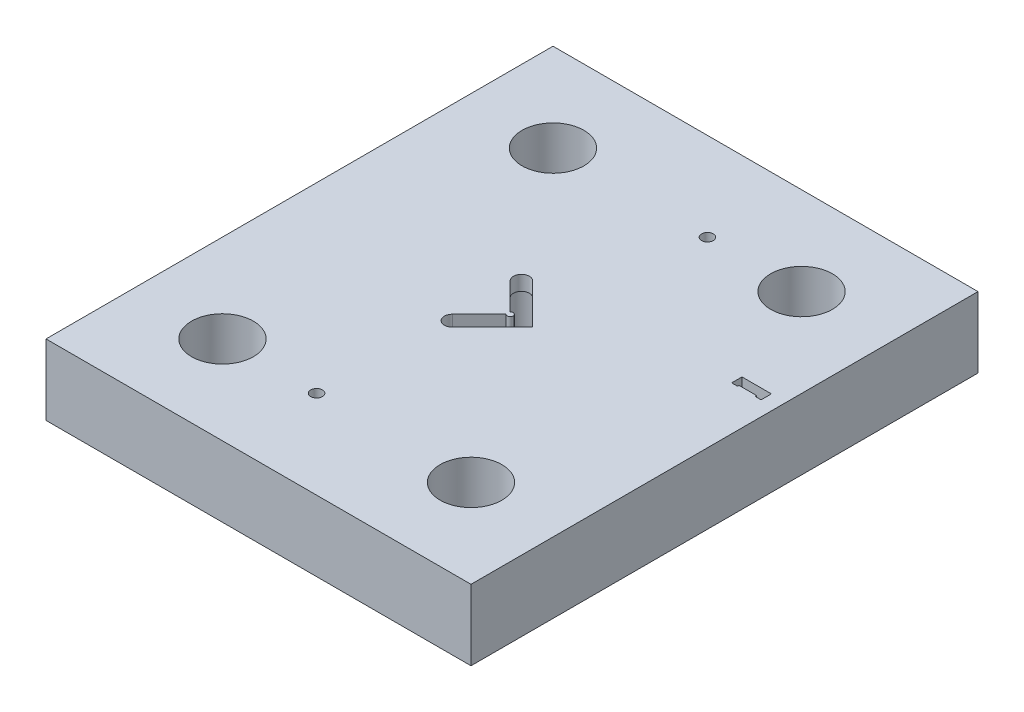
from build123d import *

# Parameters (mm, degrees)
SKETCH1_W           = 144.5
SKETCH1_H           = 172.38
BOSS_EXTRUDE1_DEPTH = 24
SKETCH2_R           = 10.5
SKETCH2_R_2         = 1.99
CUT_EXTRUDE1_DEPTH  = 80
CUT_EXTRUDE3_DEPTH  = 19


with BuildPart() as part:
    # Sketch1 → Boss-Extrude1 (new body)
    with BuildSketch(Plane(origin=(0, 0, 0), x_dir=(1, 0, 0), z_dir=(0, 1, 0))):
        Rectangle(SKETCH1_W, SKETCH1_H)
    extrude(amount=BOSS_EXTRUDE1_DEPTH)

    # Sketch2 → Cut-Extrude1 (cut)
    with BuildSketch(Plane(origin=(0, 24, 0), x_dir=(1, 0, 0), z_dir=(0, 1, 0))):
        with Locations((42.25, 56.19)):
            Circle(SKETCH2_R)
        with Locations((-42.25, 56.19)):
            Circle(SKETCH2_R)
        with Locations((-42.25, -56.19)):
            Circle(SKETCH2_R)
        with Locations((42.25, -56.19)):
            Circle(SKETCH2_R)
        with Locations((10.25, 56.19)):
            Circle(SKETCH2_R_2)
        with Locations((-10.25, -56.19)):
            Circle(SKETCH2_R_2)
        Polygon((57.25, 17.44), (59.25, 17.44), (59.25, 17.94), (65.25, 17.94), (65.25, 17.44), (67.25, 17.44), (67.25, 20.94), (57.25, 20.94), align=None)
        with BuildLine():
            Line((-10.455537495, 9.828784258), (-1.333860018, 0.707106781))
            ThreePointArc((-1.333860018, 0.707106781), (0.373246763, 0), (-1.333860018, -0.707106781))
            Line((-1.333860018, -0.707106781), (-10.455537495, -9.828784258))
            ThreePointArc((-10.455537495, -9.828784258), (-10.455537495, -13.647160877), (-6.637160877, -13.647160877))
            Line((-6.637160877, -13.647160877), (7.01, 0))
            Line((7.01, 0), (-6.637160877, 13.647160877))
            ThreePointArc((-6.637160877, 13.647160877), (-10.455537495, 13.647160877), (-10.455537495, 9.828784258))
        make_face()
    extrude(amount=-CUT_EXTRUDE1_DEPTH, mode=Mode.SUBTRACT)

    # Sketch4 → Cut-Extrude3 (cut)
    with BuildSketch(Plane.XZ):
        with BuildLine():
            Line((-4.501698398, -15.782623356), (11.252640687, -0.028284271))
            Line((11.252640687, -0.028284271), (-4.501698398, 15.726054814))
            ThreePointArc((-4.501698398, 15.726054814), (-12.534431432, 15.726054814), (-12.534431432, 7.693321779))
            Line((-12.534431432, 7.693321779), (-4.812825381, -0.028284271))
            Line((-4.812825381, -0.028284271), (-12.534431432, -7.749890322))
            ThreePointArc((-12.534431432, -7.749890322), (-12.534431432, -15.782623356), (-4.501698398, -15.782623356))
        make_face()
    extrude(amount=-CUT_EXTRUDE3_DEPTH, mode=Mode.SUBTRACT)


solid = part.part
